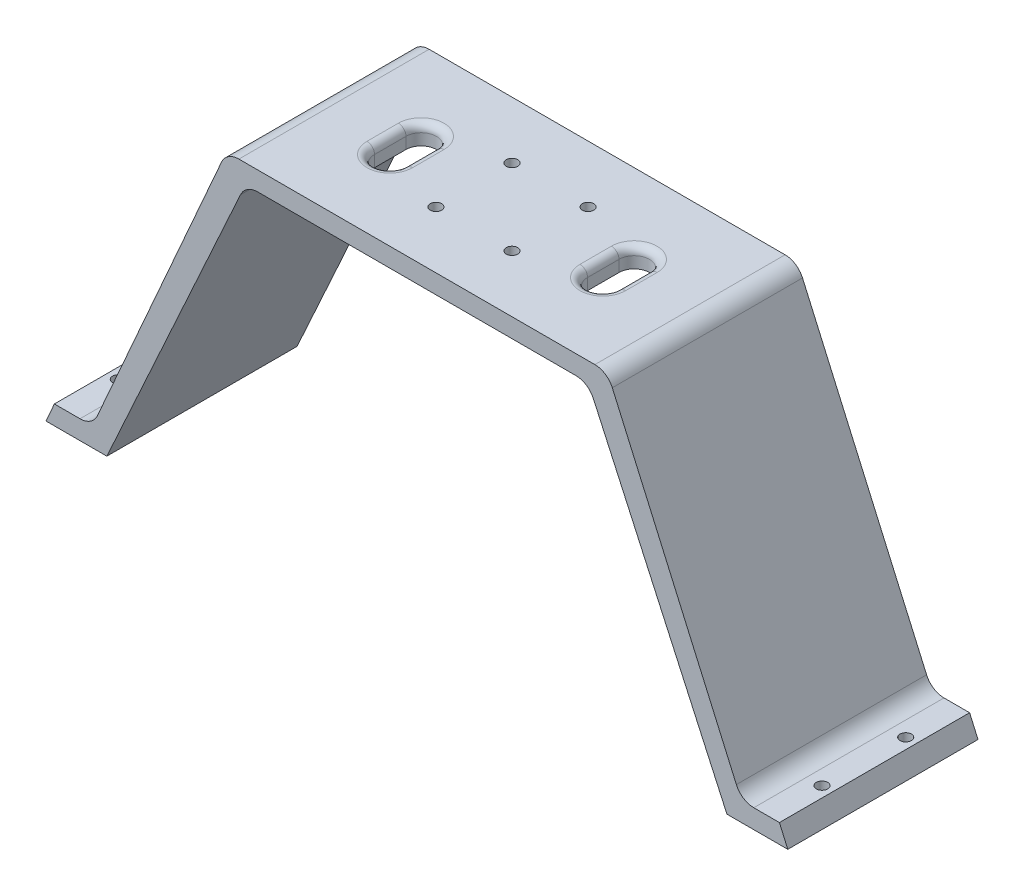
from build123d import *

# Parameters (mm, degrees)
BOSS_EXTRUDE2_DEPTH = 50
CUT_EXTRUDE1_DEPTH  = 50
FILLET1_R           = 5
SKETCH10_W          = 50
SKETCH10_H          = 5.46
BOSS_EXTRUDE4_DEPTH = 10
SKETCH5_W           = 50
SKETCH5_H           = 5.464
BOSS_EXTRUDE5_DEPTH = 10
SKETCH11_R          = 1.5
CUT_EXTRUDE2_DEPTH  = 10
SKETCH12_R          = 1.5
CUT_EXTRUDE3_DEPTH  = 10
FILLET2_R           = 5
FILLET3_R           = 5
SKETCH13_R          = 1.5
CUT_EXTRUDE5_DEPTH  = 10
SKETCH14_R          = 3
CUT_EXTRUDE6_DEPTH  = 2.5
CUT_EXTRUDE8_DEPTH  = 8.5
FILLET5_R           = 2


with BuildPart() as part:
    # Sketch1 → Boss-Extrude2 (new body)
    with BuildSketch(Plane.XY):
        Polygon((-87.5, 0), (87.5, 0), (50.05, 85), (-50.05, 85), align=None)
    extrude(amount=BOSS_EXTRUDE2_DEPTH)

    # Sketch3 → Cut-Extrude1 (cut)
    with BuildSketch(Plane.XY.offset(50)):
        Polygon((-81.5, 0), (81.5, 0), (45.05, 80), (-45.05, 80), align=None)
    extrude(amount=-CUT_EXTRUDE1_DEPTH, mode=Mode.SUBTRACT)

    # Fillet1
    fillet1_edges = [part.edges().sort_by_distance(p)[0] for p in [
        (45.05, 80, 25),
        (-45.05, 80, 25),
    ]]
    fillet(fillet1_edges, radius=FILLET1_R)

    # Sketch10 → Boss-Extrude4 (add, along a direction that is not the sketch's normal)
    with BuildSketch(Plane(origin=(-73.275840836, 32.284473404, 0), x_dir=(0, 0, 1), z_dir=(-0.9151164849241618, 0.4031895571812924, 0))):
        with Locations((25, -32.549086253)):
            Rectangle(SKETCH10_W, SKETCH10_H)
    extrude(amount=BOSS_EXTRUDE4_DEPTH, dir=(-1, 0, 0))

    # Sketch5 → Boss-Extrude5 (add, along a direction that is not the sketch's normal)
    with BuildSketch(Plane(origin=(73.275840836, 32.284473404, 0), x_dir=(0, 0, -1), z_dir=(0.9151164849241616, 0.4031895571812925, 0))):
        with Locations((-25, -32.547086253)):
            Rectangle(SKETCH5_W, SKETCH5_H)
    extrude(amount=BOSS_EXTRUDE5_DEPTH, dir=(1, 0, 0))

    # Sketch11 → Cut-Extrude2 (cut)
    with BuildSketch(Plane(origin=(0, 4.996536008, 0), x_dir=(1, 0, 0), z_dir=(0, 1, 0))):
        with Locations((-92.5, -14)):
            Circle(SKETCH11_R)
        with Locations((-92.5, -36)):
            Circle(SKETCH11_R)
    extrude(amount=-CUT_EXTRUDE2_DEPTH, mode=Mode.SUBTRACT)

    # Sketch12 → Cut-Extrude3 (cut)
    with BuildSketch(Plane(origin=(0, 5.000196474, 0), x_dir=(1, 0, 0), z_dir=(0, 1, 0))):
        with Locations((92.5, -14)):
            Circle(SKETCH12_R)
        with Locations((92.5, -36)):
            Circle(SKETCH12_R)
    extrude(amount=-CUT_EXTRUDE3_DEPTH, mode=Mode.SUBTRACT)

    # Fillet2
    fillet2_edges = [part.edges().sort_by_distance(p)[0] for p in [
        (85.29697226, 5.000196474, 25),
        (-85.298585018, 4.996536008, 25),
    ]]
    fillet(fillet2_edges, radius=FILLET2_R)

    # Fillet3
    fillet3_edges = [part.edges().sort_by_distance(p)[0] for p in [
        (50.05, 85, 25),
        (-50.05, 85, 25),
    ]]
    fillet(fillet3_edges, radius=FILLET3_R)

    # Sketch13 → Cut-Extrude5 (cut)
    with BuildSketch(Plane(origin=(0, 85, 0), x_dir=(1, 0, 0), z_dir=(0, 1, 0))):
        with Locations((-9.999155874, -15)):
            Circle(SKETCH13_R)
        with Locations((10.000844126, -15)):
            Circle(SKETCH13_R)
        with Locations((-9.999155874, -35)):
            Circle(SKETCH13_R)
        with Locations((10.000844126, -35)):
            Circle(SKETCH13_R)
    extrude(amount=-CUT_EXTRUDE5_DEPTH, mode=Mode.SUBTRACT)

    # Sketch14 → Cut-Extrude6 (cut)
    with BuildSketch(Plane.XZ.offset(-80)):
        with Locations((-9.999155874, 35)):
            Circle(SKETCH14_R)
        with Locations((-9.999155874, 15)):
            Circle(SKETCH14_R)
        with Locations((10.000844126, 35)):
            Circle(SKETCH14_R)
        with Locations((10.000844126, 15)):
            Circle(SKETCH14_R)
    extrude(amount=-CUT_EXTRUDE6_DEPTH, mode=Mode.SUBTRACT)

    # Sketch15 → Cut-Extrude8 (cut)
    with BuildSketch(Plane(origin=(0, 85, 0), x_dir=(1, 0, 0), z_dir=(0, 1, 0))):
        with BuildLine():
            Line((-23.999155874, -20.87), (-23.999155874, -29.13))
            ThreePointArc((-23.999155874, -29.13), (-27.999155874, -33.13), (-31.999155874, -29.13))
            Line((-31.999155874, -29.13), (-31.999155874, -20.87))
            ThreePointArc((-31.999155874, -20.87), (-27.999155874, -16.87), (-23.999155874, -20.87))
        make_face()
        with BuildLine():
            Line((32.000844126, -20.87), (32.000844126, -29.13))
            ThreePointArc((32.000844126, -29.13), (28.000844126, -33.13), (24.000844126, -29.13))
            Line((24.000844126, -29.13), (24.000844126, -20.87))
            ThreePointArc((24.000844126, -20.87), (28.000844126, -16.87), (32.000844126, -20.87))
        make_face()
    extrude(amount=-CUT_EXTRUDE8_DEPTH, mode=Mode.SUBTRACT)

    # Fillet5
    fillet5_edges = [part.edges().sort_by_distance(p)[0] for p in [
        (-27.999155874, 85, 33.13),
        (-23.999155874, 85, 25),
        (-31.999155874, 85, 25),
        (-27.999155874, 85, 16.87),
        (28.000844126, 85, 16.87),
        (32.000844126, 85, 25),
        (24.000844126, 85, 25),
        (28.000844126, 85, 33.13),
    ]]
    fillet(fillet5_edges, radius=FILLET5_R)


solid = part.part
